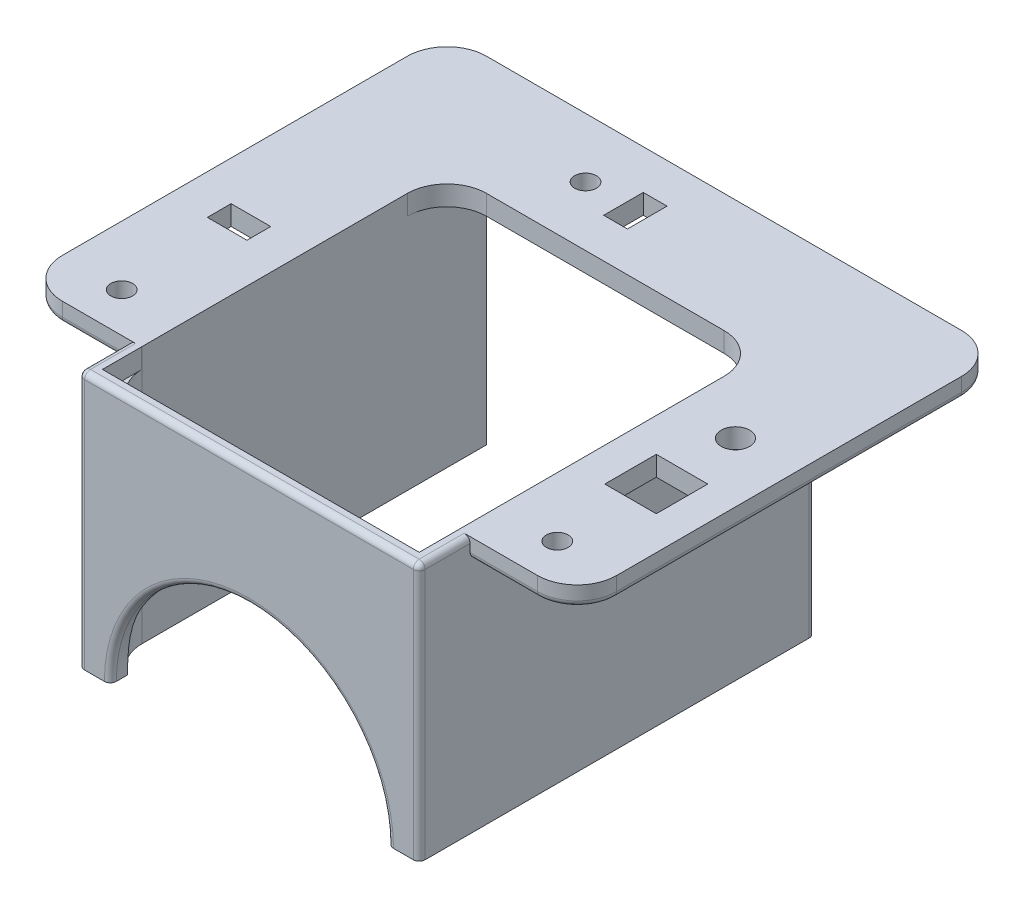
from build123d import *

# Parameters (mm, degrees)
BOSS_EXTRUDE1_DEPTH = 60
SKETCH2_W           = 30
SKETCH2_H           = 107.13499281
BOSS_EXTRUDE2_DEPTH = 5
SKETCH3_W           = 80
SKETCH3_H           = 30
BOSS_EXTRUDE3_DEPTH = 5
FILLET2_R           = 10
BOSS_EXTRUDE4_DEPTH = 5
CUT_EXTRUDE2_DEPTH  = 5
SKETCH7_R           = 2.75
CUT_EXTRUDE3_DEPTH  = 178.183520713
SKETCH8_W           = 10
SKETCH8_H           = 6
SKETCH8_W_2         = 6
SKETCH8_H_2         = 10
CUT_EXTRUDE4_DEPTH  = 178.183520713
SKETCH10_R          = 3.585
SKETCH10_W          = 13
SKETCH10_H          = 13
CUT_EXTRUDE5_DEPTH  = 178.183520713
FILLET3_R           = 1.5


with BuildPart() as part:
    # Sketch1 → Boss-Extrude1 (new body)
    with BuildSketch(Plane(origin=(0, 0, 0), x_dir=(1, 0, 0), z_dir=(0, 1, 0))):
        Polygon((0, 0), (0, 100), (3, 100), (3, 3), (83, 3), (83, 100), (86, 100), (86, 0), align=None)
    extrude(amount=BOSS_EXTRUDE1_DEPTH)

    # Sketch2 → Boss-Extrude2 (add)
    with BuildSketch(Plane(origin=(0, 60, 0), x_dir=(1, 0, 0), z_dir=(0, 1, 0))):
        with Locations((98, 66.432503591)):
            Rectangle(SKETCH2_W, SKETCH2_H)
        with Locations((-12, 66.432503591)):
            Rectangle(SKETCH2_W, SKETCH2_H)
    extrude(amount=BOSS_EXTRUDE2_DEPTH)

    # Sketch3 → Boss-Extrude3 (add)
    with BuildSketch(Plane(origin=(0, 65, 0), x_dir=(1, 0, 0), z_dir=(0, 1, 0))):
        with Locations((43, 104.999999996)):
            Rectangle(SKETCH3_W, SKETCH3_H)
    extrude(amount=-BOSS_EXTRUDE3_DEPTH)

    # Fillet2
    fillet2_edges = [part.edges().sort_by_distance(p)[0] for p in [
        (83, 30, -3),
        (3, 30, -3),
        (83, 62.5, -89.999999996),
        (3, 62.5, -89.999999996),
    ]]
    fillet(fillet2_edges, radius=FILLET2_R)
    fillet2_2_edges = [part.edges().sort_by_distance(p)[0] for p in [
        (113, 62.5, -119.999999996),
        (-27, 62.5, -119.999999996),
        (113, 62.5, -12.865007186),
        (-27, 62.5, -12.865007186),
    ]]
    fillet(fillet2_2_edges, radius=FILLET2_R)

    # Sketch5 → Boss-Extrude4 (add)
    with BuildSketch(Plane(origin=(0, 60, 0), x_dir=(1, 0, 0), z_dir=(0, 1, 0))):
        Polygon((0, 12.865007186), (0, 0), (86, 0), (86, 12.865007186), (83, 12.865007186), (83, 3), (3, 3), (3, 12.865007186), align=None)
    extrude(amount=BOSS_EXTRUDE4_DEPTH)

    # Sketch6 → Cut-Extrude2 (cut)
    with BuildSketch(Plane.XY):
        with BuildLine():
            Line((8, 0), (78, 0))
            ThreePointArc((78, 0), (43, 35), (8, 0))
        make_face()
    extrude(amount=-CUT_EXTRUDE2_DEPTH, mode=Mode.SUBTRACT)

    # Sketch7 → Cut-Extrude3 (cut, through all)
    with BuildSketch(Plane(origin=(0, 65, 0), x_dir=(1, 0, 0), z_dir=(0, 1, 0))):
        with Locations((-12, 22.865007186)):
            Circle(SKETCH7_R)
        with Locations((23, 104.999999996)):
            Circle(SKETCH7_R)
        with Locations((98, 22.865007186)):
            Circle(SKETCH7_R)
    extrude(amount=-CUT_EXTRUDE3_DEPTH, mode=Mode.SUBTRACT)

    # Sketch8 → Cut-Extrude4 (cut, through all)
    with BuildSketch(Plane(origin=(0, 65, 0), x_dir=(1, 0, 0), z_dir=(0, 1, 0))):
        with Locations((-12, 52.499999996)):
            Rectangle(SKETCH8_W, SKETCH8_H)
        with Locations((35.581142125, 104.999999996)):
            Rectangle(SKETCH8_W_2, SKETCH8_H_2)
    extrude(amount=-CUT_EXTRUDE4_DEPTH, mode=Mode.SUBTRACT)

    # Sketch10 → Cut-Extrude5 (cut, through all)
    with BuildSketch(Plane(origin=(0, 65, 0), x_dir=(1, 0, 0), z_dir=(0, 1, 0))):
        with Locations((98, 67.865007186)):
            Circle(SKETCH10_R)
        with Locations((98, 47.865007186)):
            Rectangle(SKETCH10_W, SKETCH10_H)
    extrude(amount=-CUT_EXTRUDE5_DEPTH, mode=Mode.SUBTRACT)

    # Fillet3
    fillet3_edges = [part.edges().sort_by_distance(p)[0] for p in [
        (-8.5, 60, -12.865007186),
        (-24.071067812, 60, -15.793939374),
        (-27, 60, -66.432503591),
        (-24.071067812, 60, -117.071067808),
        (43, 60, -119.999999996),
        (110.071067812, 60, -117.071067808),
        (113, 60, -66.432503591),
        (94.5, 60, -12.865007186),
        (110.071067812, 60, -15.793939374),
        (0, 32.5, 0),
        (0, 65, -6.432503593),
        (43, 65, 0),
        (86, 32.5, 0),
        (86, 65, -6.432503593),
        (0, 30, -100),
        (86, 30, -100),
        (43, 35, 0),
    ]]
    fillet(fillet3_edges, radius=FILLET3_R)


solid = part.part
